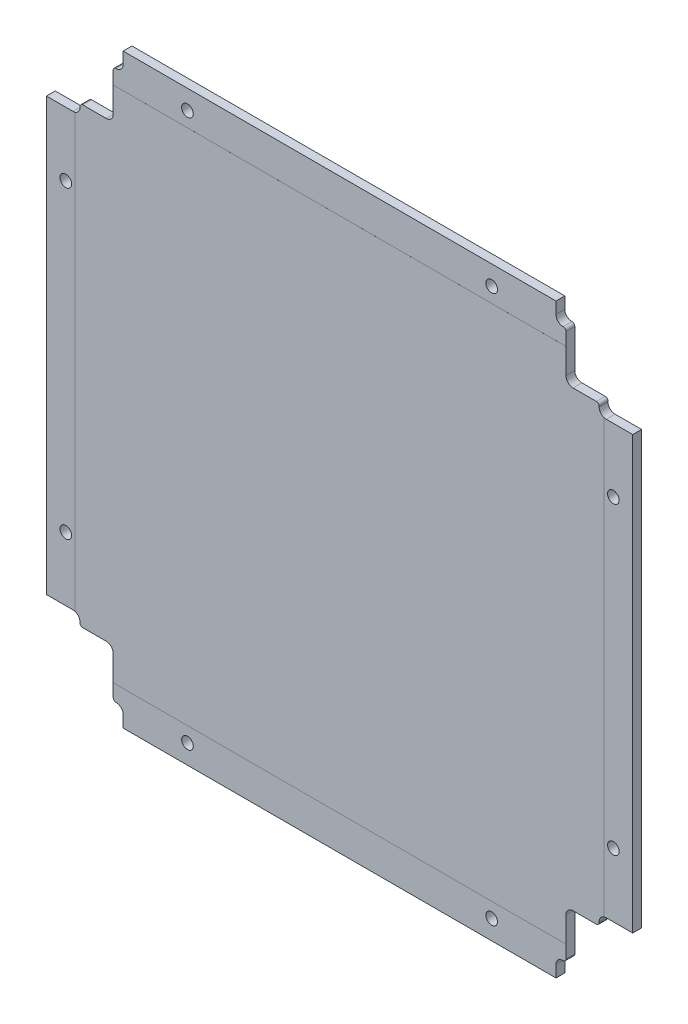
from build123d import *

# Parameters (mm, degrees)
SKETCH1_W                 = 106
SKETCH1_H                 = 106
MAINOUTLINE_DEPTH         = 1.6
SKETCH4_W                 = 11.7
SKETCH4_H                 = 11.7
RAILCUTOUTS_DEPTH         = 75.970394157
SKETCH13_W                = 5.7
SKETCH13_H                = 1.9
SKETCH13_W_2              = 1.8
SKETCH13_H_2              = 3
FILLETCUTOUTS_DEPTH       = 75.970394157
SMOOTHCORNER_DEPTH        = 10
MIRROR2_COPY_1_SKETCH_W   = 11.7
MIRROR2_COPY_1_SKETCH_H   = 11.7
MIRROR2_COPY_1_DEPTH      = 75.970394157
MIRROR2_COPY_2_SKETCH_W   = 5.7
MIRROR2_COPY_2_SKETCH_H   = 1.9
MIRROR2_COPY_2_SKETCH_W_2 = 1.8
MIRROR2_COPY_2_SKETCH_H_2 = 3
MIRROR2_COPY_2_DEPTH      = 75.970394157
MIRROR2_COPY_3_DEPTH      = 10
MIRROR2_COPY_4_SKETCH_W   = 11.7
MIRROR2_COPY_4_SKETCH_H   = 11.7
MIRROR2_COPY_4_DEPTH      = 75.970394157
MIRROR2_COPY_5_SKETCH_W   = 5.7
MIRROR2_COPY_5_SKETCH_H   = 1.9
MIRROR2_COPY_5_SKETCH_W_2 = 1.8
MIRROR2_COPY_5_SKETCH_H_2 = 3
MIRROR2_COPY_5_DEPTH      = 75.970394157
MIRROR2_COPY_6_DEPTH      = 10
FILLET10_R                = 0.5
M2_CLEARANCE_HOLE1_D      = 2.1
SKETCH16_W                = 90
SKETCH16_H                = 6.2
SKETCH16_W_2              = 5.2
SKETCH16_H_2              = 90
CUT_EXTRUDE6_DEPTH        = 0.001


with BuildPart() as part:
    # Sketch1 → mainOutline (new body)
    with BuildSketch(Plane.XY):
        Rectangle(SKETCH1_W, SKETCH1_H)
    extrude(amount=MAINOUTLINE_DEPTH)

    # Sketch4 → railCutouts (cut, through all)
    with BuildSketch(Plane(origin=(0, 0, 0), x_dir=(-1, 0, 0), z_dir=(0, 0, -1))):
        with Locations((47.15, 47.15)):
            Rectangle(SKETCH4_W, SKETCH4_H)
    railcutouts = extrude(amount=-RAILCUTOUTS_DEPTH, mode=Mode.SUBTRACT)

    # Sketch13 → filletCutouts (cut, symmetric)
    with BuildSketch(Plane(origin=(0, 0, 0), x_dir=(-1, 0, 0), z_dir=(0, 0, -1))):
        with Locations((50.15, 40.35)):
            Rectangle(SKETCH13_W, SKETCH13_H)
        with Locations((40.4, 51.5)):
            Rectangle(SKETCH13_W_2, SKETCH13_H_2)
    filletcutouts = extrude(amount=FILLETCUTOUTS_DEPTH, both=True, mode=Mode.SUBTRACT)

    # Sketch27 → smoothCorner (cut)
    with BuildSketch(Plane.XY.offset(1.6)):
        with BuildLine():
            Line((-40.928025612, 42.198025612), (-40.928025612, 49.628025612))
            Line((-40.928025612, 49.628025612), (-40.398025612, 49.628025612))
            ThreePointArc((-40.398025612, 49.628025612), (-39.5, 50), (-39.128025612, 50.898025612))
            Line((-39.128025612, 50.898025612), (-39.128025612, 53))
            Line((-39.128025612, 53), (-53, 53))
            Line((-53, 53), (-53, 39.028025612))
            Line((-53, 39.028025612), (-48.198025612, 39.028025612))
            ThreePointArc((-48.198025612, 39.028025612), (-47.3, 39.4), (-46.928025612, 40.298025612))
            Line((-46.928025612, 40.298025612), (-46.928025612, 40.928025612))
            Line((-46.928025612, 40.928025612), (-42.198025612, 40.928025612))
            ThreePointArc((-42.198025612, 40.928025612), (-41.3, 41.3), (-40.928025612, 42.198025612))
        make_face()
    smoothcorner = extrude(amount=-SMOOTHCORNER_DEPTH, mode=Mode.SUBTRACT)

    # Mirror1: railCutouts, filletCutouts, smoothCorner across plane
    add(railcutouts.mirror(Plane(origin=(0, 0, 0), x_dir=(0, 0, 1), z_dir=(1, 0, 0))), mode=Mode.SUBTRACT)
    add(filletcutouts.mirror(Plane(origin=(0, 0, 0), x_dir=(0, 0, 1), z_dir=(1, 0, 0))), mode=Mode.SUBTRACT)
    add(smoothcorner.mirror(Plane(origin=(0, 0, 0), x_dir=(0, 0, 1), z_dir=(1, 0, 0))), mode=Mode.SUBTRACT)

    # Mirror2 copy 1 sketch → Mirror2 copy 1 (cut, through all)
    with BuildSketch(Plane(origin=(0, 0, 0), x_dir=(1, 0, 0), z_dir=(0, 0, -1))):
        with Locations((47.15, 47.15)):
            Rectangle(MIRROR2_COPY_1_SKETCH_W, MIRROR2_COPY_1_SKETCH_H)
    extrude(amount=-MIRROR2_COPY_1_DEPTH, mode=Mode.SUBTRACT)

    # Mirror2 copy 2 sketch → Mirror2 copy 2 (cut, symmetric)
    with BuildSketch(Plane(origin=(0, 0, 0), x_dir=(1, 0, 0), z_dir=(0, 0, -1))):
        with Locations((50.15, 40.35)):
            Rectangle(MIRROR2_COPY_2_SKETCH_W, MIRROR2_COPY_2_SKETCH_H)
        with Locations((40.4, 51.5)):
            Rectangle(MIRROR2_COPY_2_SKETCH_W_2, MIRROR2_COPY_2_SKETCH_H_2)
    extrude(amount=MIRROR2_COPY_2_DEPTH, both=True, mode=Mode.SUBTRACT)

    # Mirror2 copy 3 sketch → Mirror2 copy 3 (cut)
    with BuildSketch(Plane(origin=(0, 0, 1.6), x_dir=(-1, 0, 0), z_dir=(0, 0, 1))):
        with BuildLine():
            Line((-40.928025612, 42.198025612), (-40.928025612, 49.628025612))
            Line((-40.928025612, 49.628025612), (-40.398025612, 49.628025612))
            ThreePointArc((-40.398025612, 49.628025612), (-39.5, 50), (-39.128025612, 50.898025612))
            Line((-39.128025612, 50.898025612), (-39.128025612, 53))
            Line((-39.128025612, 53), (-53, 53))
            Line((-53, 53), (-53, 39.028025612))
            Line((-53, 39.028025612), (-48.198025612, 39.028025612))
            ThreePointArc((-48.198025612, 39.028025612), (-47.3, 39.4), (-46.928025612, 40.298025612))
            Line((-46.928025612, 40.298025612), (-46.928025612, 40.928025612))
            Line((-46.928025612, 40.928025612), (-42.198025612, 40.928025612))
            ThreePointArc((-42.198025612, 40.928025612), (-41.3, 41.3), (-40.928025612, 42.198025612))
        make_face()
    extrude(amount=-MIRROR2_COPY_3_DEPTH, mode=Mode.SUBTRACT)

    # Mirror2 copy 4 sketch → Mirror2 copy 4 (cut, through all)
    with BuildSketch(Plane(origin=(0, 0, 0), x_dir=(-1, 0, 0), z_dir=(0, 0, -1))):
        with Locations((47.15, -47.15)):
            Rectangle(MIRROR2_COPY_4_SKETCH_W, MIRROR2_COPY_4_SKETCH_H)
    extrude(amount=-MIRROR2_COPY_4_DEPTH, mode=Mode.SUBTRACT)

    # Mirror2 copy 5 sketch → Mirror2 copy 5 (cut, symmetric)
    with BuildSketch(Plane(origin=(0, 0, 0), x_dir=(-1, 0, 0), z_dir=(0, 0, -1))):
        with Locations((50.15, -40.35)):
            Rectangle(MIRROR2_COPY_5_SKETCH_W, MIRROR2_COPY_5_SKETCH_H)
        with Locations((40.4, -51.5)):
            Rectangle(MIRROR2_COPY_5_SKETCH_W_2, MIRROR2_COPY_5_SKETCH_H_2)
    extrude(amount=MIRROR2_COPY_5_DEPTH, both=True, mode=Mode.SUBTRACT)

    # Mirror2 copy 6 sketch → Mirror2 copy 6 (cut)
    with BuildSketch(Plane.XY.offset(1.6)):
        with BuildLine():
            Line((-40.928025612, -42.198025612), (-40.928025612, -49.628025612))
            Line((-40.928025612, -49.628025612), (-40.398025612, -49.628025612))
            ThreePointArc((-40.398025612, -49.628025612), (-39.5, -50), (-39.128025612, -50.898025612))
            Line((-39.128025612, -50.898025612), (-39.128025612, -53))
            Line((-39.128025612, -53), (-53, -53))
            Line((-53, -53), (-53, -39.028025612))
            Line((-53, -39.028025612), (-48.198025612, -39.028025612))
            ThreePointArc((-48.198025612, -39.028025612), (-47.3, -39.4), (-46.928025612, -40.298025612))
            Line((-46.928025612, -40.298025612), (-46.928025612, -40.928025612))
            Line((-46.928025612, -40.928025612), (-42.198025612, -40.928025612))
            ThreePointArc((-42.198025612, -40.928025612), (-41.3, -41.3), (-40.928025612, -42.198025612))
        make_face()
    extrude(amount=-MIRROR2_COPY_6_DEPTH, mode=Mode.SUBTRACT)

    # Fillet10
    fillet10_edges = [part.edges().sort_by_distance(p)[0] for p in [
        (46.928025612, -40.928025612, 0.8),
        (40.928025612, -49.628025612, 0.8),
        (40.928025612, 49.628025612, 0.8),
        (46.928025612, 40.928025612, 0.8),
        (-46.928025612, 40.928025612, 0.8),
        (-40.928025612, 49.628025612, 0.8),
        (-46.928025612, -40.928025612, 0.8),
        (-40.928025612, -49.628025612, 0.8),
    ]]
    fillet(fillet10_edges, radius=FILLET10_R)

    # M2 Clearance Hole1 (through all)
    with Locations(Plane(origin=(0, 0, 0), x_dir=(-1, 0, 0), z_dir=(0, 0, -1))):
        with Locations((49.5, -27.5), (27.5, -49.5), (-49.5, -27.5), (-27.5, -49.5), (-27.5, 49.5), (-49.5, 27.5), (27.5, 49.5), (49.5, 27.5)):
            Hole(M2_CLEARANCE_HOLE1_D / 2)

    # Sketch16 → Cut-Extrude6 (cut)
    with BuildSketch(Plane.XY.offset(1.6)):
        with Locations((0, -49.9)):
            Rectangle(SKETCH16_W, SKETCH16_H)
        with Locations((0, 49.9)):
            Rectangle(SKETCH16_W, SKETCH16_H)
        with Locations((-50.4, 0)):
            Rectangle(SKETCH16_W_2, SKETCH16_H_2)
        with Locations((50.4, 0)):
            Rectangle(SKETCH16_W_2, SKETCH16_H_2)
    extrude(amount=-CUT_EXTRUDE6_DEPTH, mode=Mode.SUBTRACT)


solid = part.part
